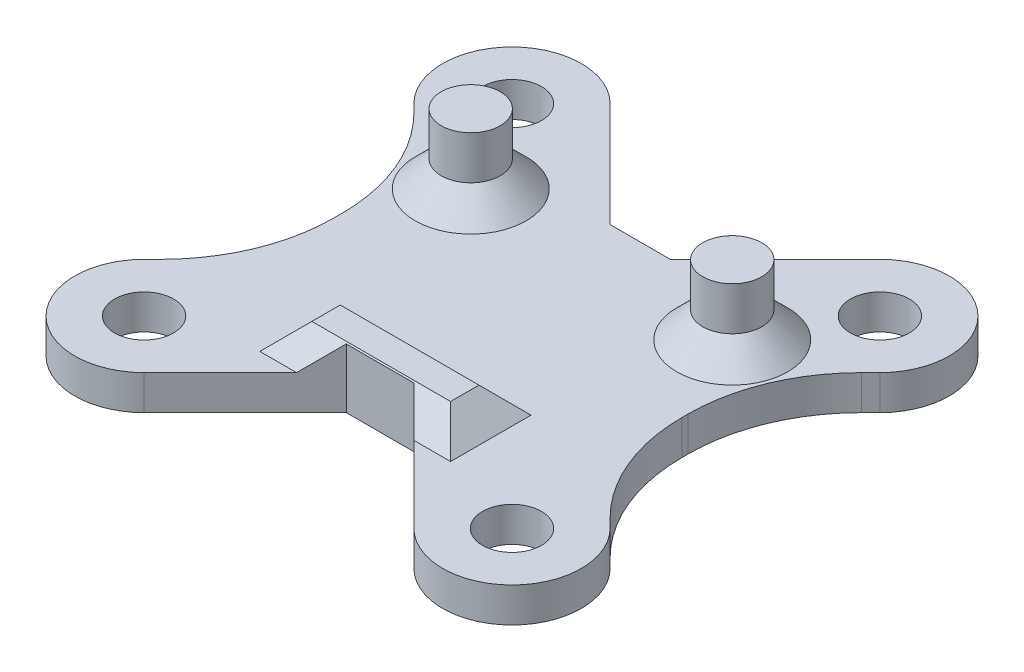
from build123d import *

# Parameters (mm, degrees)
BOSS_EXTRUDE1_DEPTH  = 2
M3_CLEARANCE_HOLE1_D = 3.4
SKETCH5_R            = 1.7
BOSS_EXTRUDE2_DEPTH  = 4
FILLET1_R            = 10
BOSS_EXTRUDE3_DEPTH  = 1.5
CHAMFER1_SIZE        = 1.5
CHAMFER2_SIZE        = 1.5


with BuildPart() as part:
    # Sketch2 → Boss-Extrude1 (new body)
    with BuildSketch(Plane(origin=(0, 0, 0), x_dir=(1, 0, 0), z_dir=(0, 1, 0))):
        with BuildLine():
            Line((-13.435028843, 7.778174593), (-10.02863265, 4.371778401))
            Line((-10.02863265, 4.371778401), (-10.02863265, -4.371778401))
            Line((-10.02863265, -4.371778401), (-13.435028843, -7.778174593))
            ThreePointArc((-13.435028843, -7.778174593), (-13.435028843, -13.435028843), (-7.778174593, -13.435028843))
            Line((-7.778174593, -13.435028843), (-1.949747468, -7.606601718))
            Line((-1.949747468, -7.606601718), (1.949747468, -7.606601718))
            Line((1.949747468, -7.606601718), (7.778174593, -13.435028843))
            ThreePointArc((7.778174593, -13.435028843), (13.435028843, -13.435028843), (13.435028843, -7.778174593))
            Line((13.435028843, -7.778174593), (9.97136735, -4.3145131))
            Line((9.97136735, -4.3145131), (9.97136735, 4.3145131))
            Line((9.97136735, 4.3145131), (13.435028843, 7.778174593))
            ThreePointArc((13.435028843, 7.778174593), (13.435028843, 13.435028843), (7.778174593, 13.435028843))
            Line((7.778174593, 13.435028843), (1.736544033, 7.393398282))
            Line((1.736544033, 7.393398282), (-1.736544033, 7.393398282))
            Line((-1.736544033, 7.393398282), (-7.778174593, 13.435028843))
            ThreePointArc((-7.778174593, 13.435028843), (-13.435028843, 13.435028843), (-13.435028843, 7.778174593))
        make_face()
    extrude(amount=BOSS_EXTRUDE1_DEPTH)

    # M3 Clearance Hole1 (through all)
    with Locations(Plane(origin=(0, 2, 0), x_dir=(1, 0, 0), z_dir=(0, 1, 0))):
        with Locations((-10.606601718, -10.606601718), (10.606601718, -10.606601718), (10.606601718, 10.606601718), (-10.606601718, 10.606601718)):
            Hole(M3_CLEARANCE_HOLE1_D / 2)

    # Sketch5 → Boss-Extrude2 (add)
    with BuildSketch(Plane(origin=(0, 2, 0), x_dir=(1, 0, 0), z_dir=(0, 1, 0))):
        with Locations(Location((-7.54, 5.16, 0), (0, 0, 270))):
            Circle(SKETCH5_R)
        with Locations(Location((7.54, 5.16, 0), (0, 0, 270))):
            Circle(SKETCH5_R)
    extrude(amount=BOSS_EXTRUDE2_DEPTH)

    # Fillet1
    fillet1_edges = [part.edges().sort_by_distance(p)[0] for p in [
        (-10.02863265, 1, -4.371778401),
        (-10.02863265, 1, 4.371778401),
        (9.97136735, 1, 4.3145131),
        (9.97136735, 1, -4.3145131),
    ]]
    fillet(fillet1_edges, radius=FILLET1_R)

    # Sketch5<3> → Boss-Extrude3 (add)
    with BuildSketch(Plane(origin=(0, 2, 0), x_dir=(1, 0, 0), z_dir=(0, 1, 0))):
        Polygon((-4, -5.90406477), (-4, -7.54), (0, -7.54), (4, -7.54), (4, -5.90406477), align=None)
    extrude(amount=BOSS_EXTRUDE3_DEPTH)

    # Chamfer1
    chamfer1_edges = [part.edges().sort_by_distance(p)[0] for p in [
        (7.54, 2, -6.86),
        (-7.54, 2, -6.86),
    ]]
    chamfer(chamfer1_edges, length=CHAMFER1_SIZE)

    # Chamfer2
    # the kernel refuses this chamfer: 1.5 mm, written as the material it adds along each edge
    with BuildSketch(Plane(origin=(7.857524482, 2, 5.90406477), x_dir=(0, 0, -1), z_dir=(-1, 0, 0))) as chamfer2_piece_1_section:
        Polygon((CHAMFER2_SIZE, 0), (0, -CHAMFER2_SIZE), (0, 0), align=None)
    chamfer2_piece_1 = extrude(amount=15.715048964, mode=Mode.PRIVATE)
    chamfer2_piece_1 = split(chamfer2_piece_1, bisect_by=Plane(origin=(1.178762241, 8.678762241, 5.90406477), z_dir=(0.7071067811865476, -0.7071067811865476, 0)), keep=Keep.TOP, mode=Mode.PRIVATE)
    chamfer2_piece_1 = split(chamfer2_piece_1, bisect_by=Plane(origin=(6.678762241, 0.821237759, 5.90406477), z_dir=(-0.7071067811865476, -0.7071067811865476, 0)), keep=Keep.TOP, mode=Mode.PRIVATE)
    add(chamfer2_piece_1)
    with BuildSketch(Plane(origin=(-4, 2, 2.046540288), x_dir=(-1, 0, 0), z_dir=(0, 0, 1))) as chamfer2_piece_2_section:
        Polygon((CHAMFER2_SIZE, 0), (0, -CHAMFER2_SIZE), (0, 0), align=None)
    chamfer2_piece_2 = extrude(amount=9.350984194, mode=Mode.PRIVATE)
    chamfer2_piece_2 = split(chamfer2_piece_2, bisect_by=Plane(origin=(-4, 5.496729856, 5.543270144), z_dir=(0, -0.7071067811865474, -0.7071067811865477)), keep=Keep.TOP, mode=Mode.PRIVATE)
    chamfer2_piece_2 = split(chamfer2_piece_2, bisect_by=Plane(origin=(-4, 0.821237759, 3.225302529), z_dir=(0, -0.7071067811865476, 0.7071067811865476)), keep=Keep.TOP, mode=Mode.PRIVATE)
    add(chamfer2_piece_2)
    with BuildSketch(Plane(origin=(-7.857524482, 2, 7.54), x_dir=(0, 0, 1), z_dir=(1, 0, 0))) as chamfer2_piece_3_section:
        Polygon((CHAMFER2_SIZE, 0), (0, -CHAMFER2_SIZE), (0, 0), align=None)
    chamfer2_piece_3 = extrude(amount=15.715048964, mode=Mode.PRIVATE)
    chamfer2_piece_3 = split(chamfer2_piece_3, bisect_by=Plane(origin=(-4.870335116, 2, 10.527189366), z_dir=(-0.7071067811865475, 0, -0.7071067811865476)), keep=Keep.TOP, mode=Mode.PRIVATE)
    chamfer2_piece_3 = split(chamfer2_piece_3, bisect_by=Plane(origin=(-6.678762241, 0.821237759, 7.54), z_dir=(0.7071067811865476, -0.7071067811865476, 0)), keep=Keep.TOP, mode=Mode.PRIVATE)
    add(chamfer2_piece_3)
    with BuildSketch(Plane(origin=(-7.857524482, 2, 7.54), x_dir=(0, 0, 1), z_dir=(1, 0, 0))) as chamfer2_piece_4_section:
        Polygon((CHAMFER2_SIZE, 0), (0, -CHAMFER2_SIZE), (0, 0), align=None)
    chamfer2_piece_4 = extrude(amount=15.715048964, mode=Mode.PRIVATE)
    chamfer2_piece_4 = split(chamfer2_piece_4, bisect_by=Plane(origin=(-7.857524482, 2, 7.606601718), z_dir=(0, 0, -1)), keep=Keep.TOP, mode=Mode.PRIVATE)
    chamfer2_piece_4 = split(chamfer2_piece_4, bisect_by=Plane(origin=(-6.678762241, 0.821237759, 7.54), z_dir=(0.7071067811865476, -0.7071067811865476, 0)), keep=Keep.TOP, mode=Mode.PRIVATE)
    chamfer2_piece_4 = split(chamfer2_piece_4, bisect_by=Plane(origin=(-1.178762241, 8.678762241, 7.54), z_dir=(-0.7071067811865476, -0.7071067811865476, 0)), keep=Keep.TOP, mode=Mode.PRIVATE)
    add(chamfer2_piece_4)
    with BuildSketch(Plane(origin=(-7.857524482, 2, 7.54), x_dir=(0, 0, 1), z_dir=(1, 0, 0))) as chamfer2_piece_5_section:
        Polygon((CHAMFER2_SIZE, 0), (0, -CHAMFER2_SIZE), (0, 0), align=None)
    chamfer2_piece_5 = extrude(amount=15.715048964, mode=Mode.PRIVATE)
    chamfer2_piece_5 = split(chamfer2_piece_5, bisect_by=Plane(origin=(-2.987189366, 2, 2.669664884), z_dir=(0.7071067811865515, 0, -0.7071067811865437)), keep=Keep.TOP, mode=Mode.PRIVATE)
    chamfer2_piece_5 = split(chamfer2_piece_5, bisect_by=Plane(origin=(-1.178762241, 8.678762241, 7.54), z_dir=(-0.7071067811865476, -0.7071067811865476, 0)), keep=Keep.TOP, mode=Mode.PRIVATE)
    add(chamfer2_piece_5)
    with BuildSketch(Plane(origin=(4, 2, 11.397524482), x_dir=(1, 0, 0), z_dir=(0, 0, -1))) as chamfer2_piece_6_section:
        Polygon((CHAMFER2_SIZE, 0), (0, -CHAMFER2_SIZE), (0, 0), align=None)
    chamfer2_piece_6 = extrude(amount=9.350984194, mode=Mode.PRIVATE)
    chamfer2_piece_6 = split(chamfer2_piece_6, bisect_by=Plane(origin=(4, 0.821237759, 10.218762241), z_dir=(0, -0.7071067811865474, -0.7071067811865477)), keep=Keep.TOP, mode=Mode.PRIVATE)
    chamfer2_piece_6 = split(chamfer2_piece_6, bisect_by=Plane(origin=(4, 5.496729856, 7.900794626), z_dir=(0, -0.7071067811865476, 0.7071067811865476)), keep=Keep.TOP, mode=Mode.PRIVATE)
    add(chamfer2_piece_6)


solid = part.part
